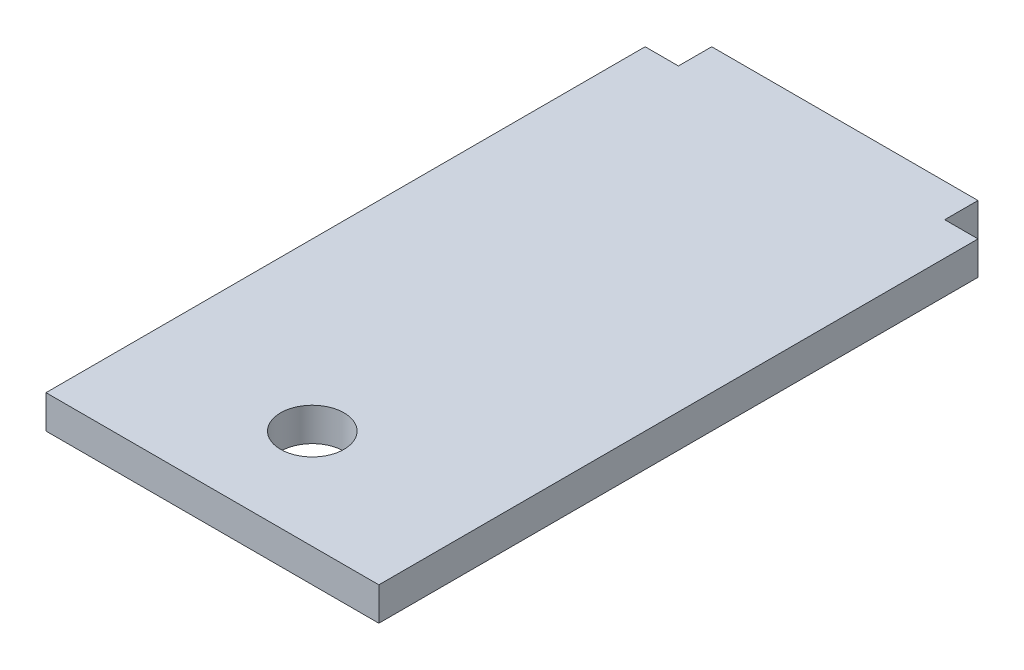
from build123d import *

# Parameters (mm, degrees)
SKETCH1_R    = 4.7625
HAMMER_DEPTH = 5


with BuildPart() as part:
    # Sketch1 → Hammer (new body)
    with BuildSketch(Plane(origin=(0, 0, 0), x_dir=(1, 0, 0), z_dir=(0, 1, 0))):
        Polygon((0, 90), (5, 90), (5, 95), (45, 95), (45, 90), (50, 90), (50, 0), (0, 0), align=None)
        with Locations((25, 15)):
            Circle(SKETCH1_R, mode=Mode.SUBTRACT)
    extrude(amount=HAMMER_DEPTH)


solid = part.part
